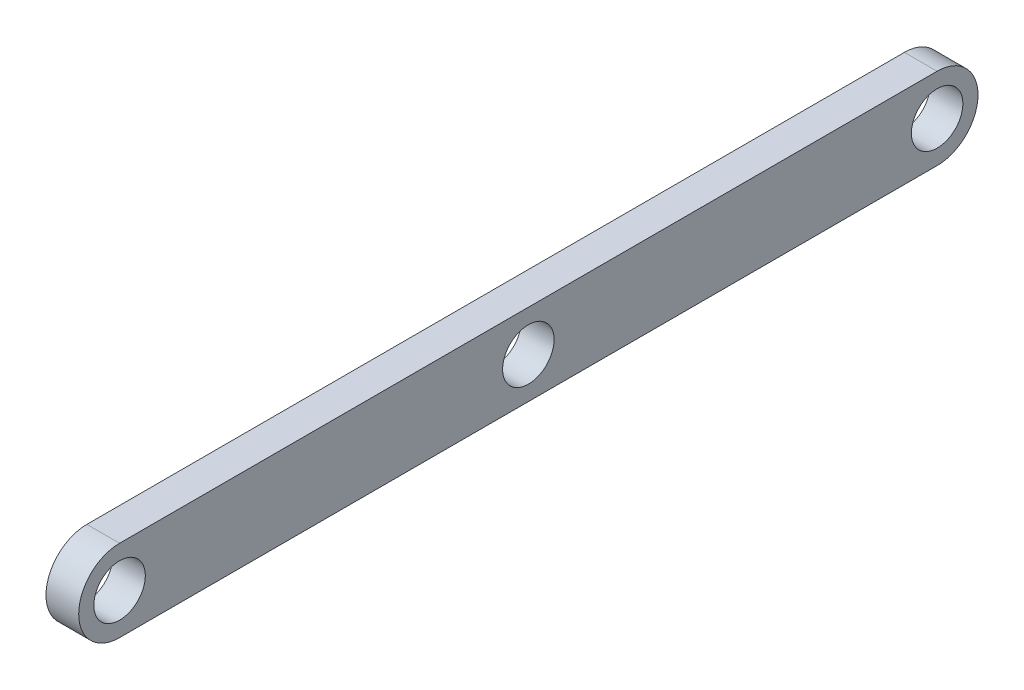
from build123d import *

# Parameters (mm, degrees)
BOSS_EXTRUDE1_DEPTH   = 5.08
F_8_0MM_DOWEL_HOLE1_D = 8


with BuildPart() as part:
    # Sketch1 → Boss-Extrude1 (new body)
    with BuildSketch(Plane(origin=(0, 0, 0), x_dir=(0, 0, -1), z_dir=(1, 0, 0))):
        with BuildLine():
            Line((-77.47, 8.41375), (49.53, 8.41375))
            ThreePointArc((49.53, 8.41375), (55.88, 2.06375), (49.53, -4.28625))
            Line((49.53, -4.28625), (-77.47, -4.28625))
            ThreePointArc((-77.47, -4.28625), (-83.82, 2.06375), (-77.47, 8.41375))
        make_face()
    extrude(amount=BOSS_EXTRUDE1_DEPTH)

    # Ø8.0mm Dowel Hole1 (through all)
    with Locations(Plane(origin=(5.08, 0, 0), x_dir=(0, 0, -1), z_dir=(1, 0, 0))):
        with Locations((-77.47, 2.06375), (49.53, 2.06375), (-13.97, 2.06375)):
            Hole(F_8_0MM_DOWEL_HOLE1_D / 2)


solid = part.part
